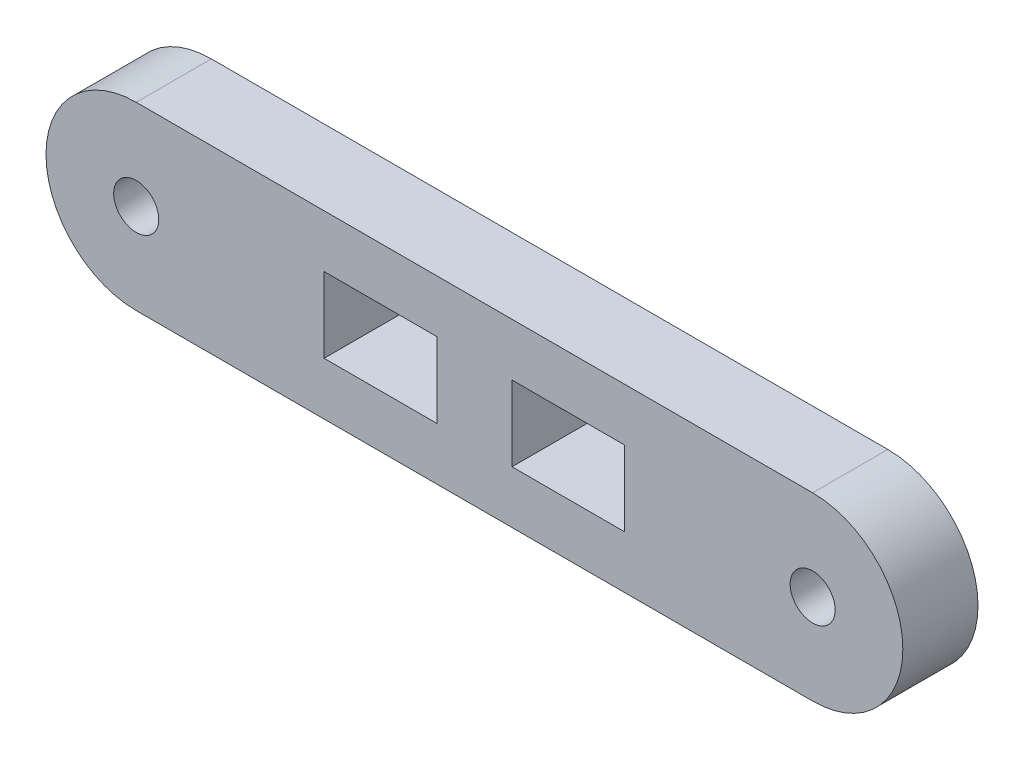
from build123d import *

# Parameters (mm, degrees)
ESQUISSE1_R        = 1.5
ESQUISSE1_W        = 7.5
ESQUISSE1_H        = 5
BOSS_EXTRU_1_DEPTH = 5


with BuildPart() as part:
    # Esquisse1 → Boss.-Extru.1 (new body)
    with BuildSketch(Plane.XY):
        with BuildLine():
            Line((45, -6), (0, -6))
            ThreePointArc((0, -6), (-6, 0), (0, 6))
            Line((0, 6), (45, 6))
            ThreePointArc((45, 6), (51, 0), (45, -6))
        make_face()
        with Locations((45, 0)):
            Circle(ESQUISSE1_R, mode=Mode.SUBTRACT)
        Circle(ESQUISSE1_R, mode=Mode.SUBTRACT)
        with Locations((28.75, 0)):
            Rectangle(ESQUISSE1_W, ESQUISSE1_H, mode=Mode.SUBTRACT)
        with Locations((16.25, 0)):
            Rectangle(ESQUISSE1_W, ESQUISSE1_H, mode=Mode.SUBTRACT)
    extrude(amount=BOSS_EXTRU_1_DEPTH)


solid = part.part
